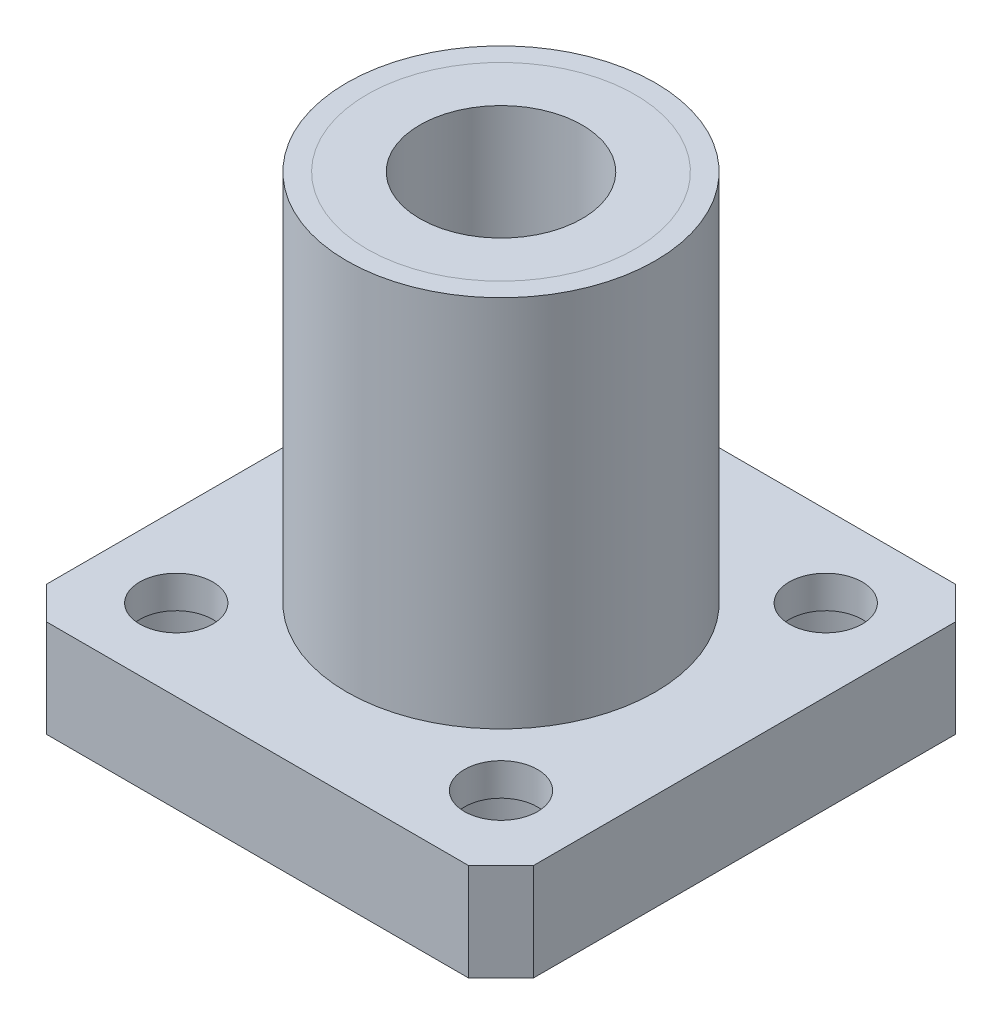
from build123d import *
from build123d.topology import SkipClean

# Parameters (mm, degrees)
SKETCH1_W                     = 30
SKETCH1_H                     = 30
SKETCH1_R                     = 9.5
BOSS_EXTRUDE1_DEPTH           = 6
SKETCH1_2_R                   = 9.5
BOSS_EXTRUDE3_DEPTH           = 55
SPLIT1_OUTLINE_R              = 9.5
SPLIT1_OUTLINE_R_2            = 8.25
SPLIT1_DEPTH                  = 55
SPLIT1_2_OUTLINE_R            = 9.5
SPLIT1_2_OUTLINE_R_2          = 8.25
SPLIT1_2_DEPTH                = 55
MOVE_START                    = 53.8
MOVE_FACE1_OUTLINE_R          = 8.25
MOVE_FACE1_DEPTH              = 1.2
MOVE_FACE2_OUTLINE_R          = 8.25
MOVE_FACE2_DEPTH              = 1.2
SKETCH5_R                     = 5
CUT_EXTRUDE1_DEPTH            = 58.831133484
SKETCH6_R                     = 5.5
SKETCH6_R_2                   = 5
EXTRUDE_THIN1_DEPTH           = 0.5
SKETCH7_R                     = 5.5
SKETCH7_R_2                   = 5
EXTRUDE_THIN2_DEPTH           = 0.5
FILLET1_R                     = 0.5
CBORE_FOR_M4_SHCS1_AT_2_COUNT = 2
CBORE_FOR_M4_SHCS1_AT_2_PITCH = 20
CBORE_FOR_M4_SHCS1_AT_3_COUNT = 2
CBORE_FOR_M4_SHCS1_AT_3_PITCH = 28.284271247
CBORE_FOR_M4_SHCS1_AT_4_COUNT = 2
CBORE_FOR_M4_SHCS1_AT_4_PITCH = 20
CHAMFER1_SIZE                 = 2
CUT_EXTRUDE2_DEPTH            = 10
CUT_EXTRUDE2_DEPTH_BACK       = 24.8
SKETCH11_R                    = 15.315618243


# Read off the part's stored shape, not the designer's step: Split1, Move Face1, Move Face2
with BuildPart() as part:
    # Sketch1 → Boss-Extrude1 (new body)
    with BuildSketch(Plane(origin=(0, 0, 0), x_dir=(1, 0, 0), z_dir=(0, 1, 0))):
        Rectangle(SKETCH1_W, SKETCH1_H)
        with Locations(Location((0, 0, 0), (0, 0, 270))):
            Circle(SKETCH1_R, mode=Mode.SUBTRACT)
    extrude(amount=BOSS_EXTRUDE1_DEPTH)

    # Sketch10 → CBORE for M4 SHCS1 (revolve, cut)
    with BuildSketch(Plane(origin=(10, 0, 10), x_dir=(0, 0, -1), z_dir=(1, 0, 0))):
        Polygon((0, 0), (0, 6.001), (2.25, 6.001), (2.25, 4), (4, 4), (4, 0.25), (4.25, 0), align=None)
    cbore_for_m4_shcs1 = revolve(axis=Axis((10, -6.35, 10), (0, 1, 0)), mode=Mode.SUBTRACT)

    # CBORE for M4 SHCS1 at 2: CBORE for M4 SHCS1 ×2
    with Locations(*[(0, 0, -i * CBORE_FOR_M4_SHCS1_AT_2_PITCH) for i in range(1, CBORE_FOR_M4_SHCS1_AT_2_COUNT)]):
        add(cbore_for_m4_shcs1, mode=Mode.SUBTRACT)

    # CBORE for M4 SHCS1 at 3: CBORE for M4 SHCS1 ×2
    with Locations(*[Vector(-0.7071067811865476, 0, -0.7071067811865476) * (i * CBORE_FOR_M4_SHCS1_AT_3_PITCH) for i in range(1, CBORE_FOR_M4_SHCS1_AT_3_COUNT)]):
        add(cbore_for_m4_shcs1, mode=Mode.SUBTRACT)

    # CBORE for M4 SHCS1 at 4: CBORE for M4 SHCS1 ×2
    with Locations(*[(-i * CBORE_FOR_M4_SHCS1_AT_4_PITCH, 0, 0) for i in range(1, CBORE_FOR_M4_SHCS1_AT_4_COUNT)]):
        add(cbore_for_m4_shcs1, mode=Mode.SUBTRACT)

    # Chamfer1
    chamfer1_edges = [part.edges().sort_by_distance(p)[0] for p in [
        (15, 3, 15),
        (-15, 3, 15),
        (-15, 3, -15),
        (15, 3, -15),
    ]]
    chamfer(chamfer1_edges, length=CHAMFER1_SIZE)


with BuildPart() as body_2:
    # Sketch1<2> → Boss-Extrude3 (new body)
    with BuildSketch(Plane(origin=(0, 0, 0), x_dir=(1, 0, 0), z_dir=(0, 1, 0))):
        with Locations(Location((0, 0, 0), (0, 0, 270))):
            Circle(SKETCH1_2_R)
    extrude(amount=BOSS_EXTRUDE3_DEPTH)

    # Split1 outline → Split1 (cut)
    with BuildSketch(Plane(origin=(0, 0, 0), x_dir=(1, 0, 0), z_dir=(0, 1, 0))):
        Circle(SPLIT1_OUTLINE_R)
        Circle(SPLIT1_OUTLINE_R_2, mode=Mode.SUBTRACT)
    extrude(amount=SPLIT1_DEPTH, mode=Mode.SUBTRACT)

    # Move Face1 outline → Move Face1 (cut)
    with BuildSketch(Plane(origin=(0, 0, 0), x_dir=(1, 0, 0), z_dir=(0, 1, 0)).offset(MOVE_START)):
        Circle(MOVE_FACE1_OUTLINE_R)
    extrude(amount=MOVE_FACE1_DEPTH, mode=Mode.SUBTRACT)

    # Move Face2 outline → Move Face2 (cut)
    with BuildSketch(Plane(origin=(0, 0, 0), x_dir=(1, 0, 0), z_dir=(0, 1, 0))):
        Circle(MOVE_FACE2_OUTLINE_R)
    extrude(amount=MOVE_FACE2_DEPTH, mode=Mode.SUBTRACT)

    # Sketch5 → Cut-Extrude1 (cut, through all)
    with BuildSketch(Plane(origin=(0, 53.8, 0), x_dir=(1, 0, 0), z_dir=(0, 1, 0))):
        with Locations(Location((0, 0, 0), (0, 0, 270))):
            Circle(SKETCH5_R)
    extrude(amount=-CUT_EXTRUDE1_DEPTH, mode=Mode.SUBTRACT)

    # Sketch6 → Extrude-Thin1 (add)
    with BuildSketch(Plane(origin=(0, 53.8, 0), x_dir=(1, 0, 0), z_dir=(0, 1, 0))):
        Circle(SKETCH6_R)
        Circle(SKETCH6_R_2, mode=Mode.SUBTRACT)
    extrude(amount=EXTRUDE_THIN1_DEPTH)

    # Sketch7 → Extrude-Thin2 (add)
    with SkipClean():  # the faces are left unmerged after this step: merging them gives an invalid solid
        with BuildSketch(Plane.XZ.offset(-1.2)):
            Circle(SKETCH7_R)
            Circle(SKETCH7_R_2, mode=Mode.SUBTRACT)
        extrude(amount=EXTRUDE_THIN2_DEPTH)


with BuildPart() as body_3:
    # Split1 2 outline → Split1 2 (new body)
    with BuildSketch(Plane(origin=(0, 0, 0), x_dir=(1, 0, 0), z_dir=(0, 1, 0))):
        Circle(SPLIT1_2_OUTLINE_R)
        Circle(SPLIT1_2_OUTLINE_R_2, mode=Mode.SUBTRACT)
    extrude(amount=SPLIT1_2_DEPTH)

    # Fillet1
    fillet1_edges = [body_3.edges().sort_by_distance(p)[0] for p in [
        (-8.25, 55, 0),
        (-9.5, 55, 0),
        (-8.25, 0, 0),
    ]]
    fillet(fillet1_edges, radius=FILLET1_R)


with BuildPart() as cut_extrude2_tool:
    # Sketch11 → Cut-Extrude2 (new, two sides: drawn at the far end of the back side and taken through both)
    with BuildSketch(Plane(origin=(0, 53.8, 0), x_dir=(1, 0, 0), z_dir=(0, 1, 0)).offset(-CUT_EXTRUDE2_DEPTH_BACK)):
        Circle(SKETCH11_R)
    extrude(amount=CUT_EXTRUDE2_DEPTH + CUT_EXTRUDE2_DEPTH_BACK)


with BuildPart() as body_2_1:
    add(body_2.part)

    # Cut-Extrude2: cut by cut_extrude2_tool
    add(cut_extrude2_tool.part, mode=Mode.SUBTRACT)


with BuildPart() as body_3_1:
    add(body_3.part)

    # Cut-Extrude2: cut by cut_extrude2_tool
    add(cut_extrude2_tool.part, mode=Mode.SUBTRACT)


solid = Compound([part.part, body_2_1.part, body_3_1.part])
